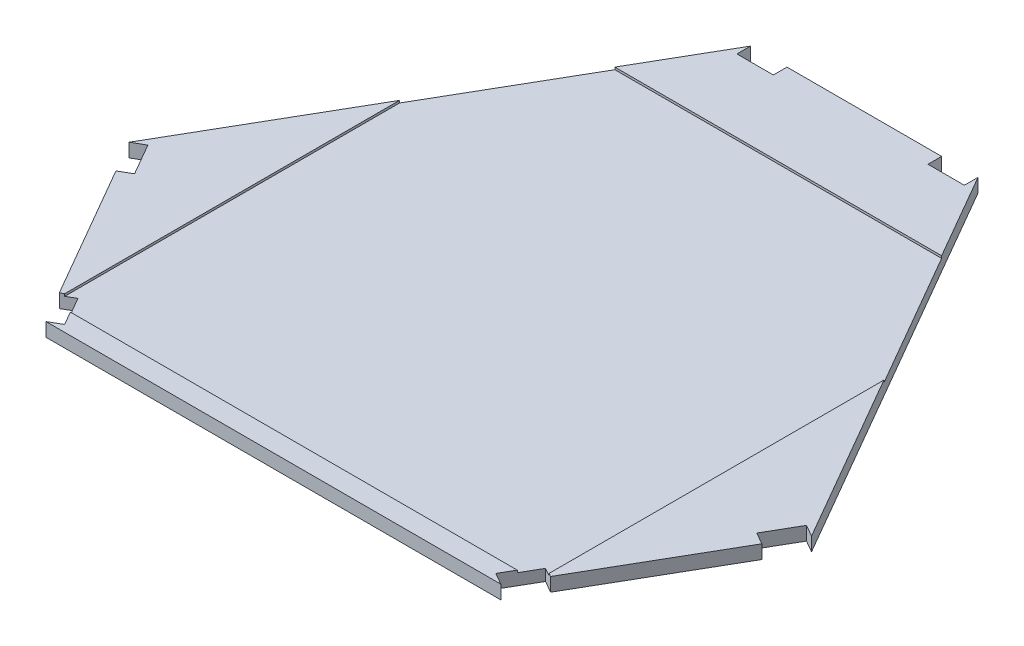
from build123d import *

# Parameters (mm, degrees)
BOSS_EXTRUDE1_DEPTH     = 3
SKETCH2_W               = 106.5
SKETCH2_H               = 106.5
CUT_EXTRUDE1_DEPTH      = 0.5
SKETCH4_W               = 8
SKETCH4_H               = 3
CUT_EXTRUDE2_DEPTH      = 105.126526789
CIRPATTERN1_START       = -24.999999535
CIRPATTERN1_OUTLINE_W   = 3
CIRPATTERN1_OUTLINE_H   = 3
CIRPATTERN1_DEPTH       = 8
CIRPATTERN1_START_2     = 16.999999535
CIRPATTERN1_2_OUTLINE_W = 3
CIRPATTERN1_2_OUTLINE_H = 3
CIRPATTERN1_2_DEPTH     = 8
CIRPATTERN1_3_DEPTH     = 8
CIRPATTERN1_4_DEPTH     = 8


# Read off the part's stored shape, not the designer's step: CirPattern1
with BuildPart() as part:
    # Sketch1 → Boss-Extrude1 (new body)
    with BuildSketch(Plane(origin=(0, 0, 0), x_dir=(1, 0, 0), z_dir=(0, 1, 0))):
        Polygon((-25.000000465, 72.168783917), (24.999999535, 72.168783917), (75.000001394, -14.433756462), (49.999999071, -57.735027455), (-50, -57.735027455), (-75.000000465, -14.433756462), align=None)
    extrude(amount=BOSS_EXTRUDE1_DEPTH)

    # Sketch2 → Cut-Extrude1 (cut)
    with BuildSketch(Plane(origin=(0, 3, 0), x_dir=(1, 0, 0), z_dir=(0, 1, 0))):
        Rectangle(SKETCH2_W, SKETCH2_H)
    extrude(amount=-CUT_EXTRUDE1_DEPTH, mode=Mode.SUBTRACT)

    # Sketch4 → Cut-Extrude2 (cut, through all)
    with BuildSketch(Plane.XZ):
        with Locations((20.999999535, -70.668783917)):
            Rectangle(SKETCH4_W, SKETCH4_H)
    cut_extrude2 = extrude(amount=-CUT_EXTRUDE2_DEPTH, mode=Mode.SUBTRACT)

    # Mirror1: Cut-Extrude2 across plane
    add(cut_extrude2.mirror(Plane(origin=(0, 0, 0), x_dir=(0, 0, 1), z_dir=(1, 0, 0))), mode=Mode.SUBTRACT)

    # CirPattern1 outline → CirPattern1 (cut)
    with BuildSketch(Plane(origin=(0, 0, 0), x_dir=(0.8660254037844362, 0, -0.5000000000000042), z_dir=(0.5000000000000042, 0, 0.8660254037844363)).offset(CIRPATTERN1_START)):
        with Locations((-70.668783917, 1.5)):
            Rectangle(CIRPATTERN1_OUTLINE_W, CIRPATTERN1_OUTLINE_H)
    extrude(amount=CIRPATTERN1_DEPTH, mode=Mode.SUBTRACT)

    # CirPattern1 2 outline → CirPattern1 2 (cut)
    with BuildSketch(Plane(origin=(0, 0, 0), x_dir=(0.8660254037844362, 0, -0.5000000000000042), z_dir=(0.5000000000000042, 0, 0.8660254037844363)).offset(CIRPATTERN1_START_2)):
        with Locations((-70.668783917, 1.5)):
            Rectangle(CIRPATTERN1_2_OUTLINE_W, CIRPATTERN1_2_OUTLINE_H)
    extrude(amount=CIRPATTERN1_2_DEPTH, mode=Mode.SUBTRACT)

    # CirPattern1 3 outline → CirPattern1 3 (cut)
    with BuildSketch(Plane(origin=(0, 0, 0), x_dir=(0.8660254037844431, 0, 0.4999999999999921), z_dir=(0.4999999999999921, 0, -0.8660254037844433)).offset(CIRPATTERN1_START)):
        Polygon((69.168783917, -3), (72.168784721, -3), (72.168784587, 0), (69.168783917, 0), align=None)
    extrude(amount=CIRPATTERN1_3_DEPTH, mode=Mode.SUBTRACT)

    # CirPattern1 4 outline → CirPattern1 4 (cut)
    with BuildSketch(Plane(origin=(0, 0, 0), x_dir=(0.8660254037844431, 0, 0.4999999999999921), z_dir=(0.4999999999999921, 0, -0.8660254037844433)).offset(CIRPATTERN1_START_2)):
        Polygon((69.168783917, -3), (72.168784721, -3), (72.168784587, 0), (69.168783917, 0), align=None)
    extrude(amount=CIRPATTERN1_4_DEPTH, mode=Mode.SUBTRACT)


solid = part.part
